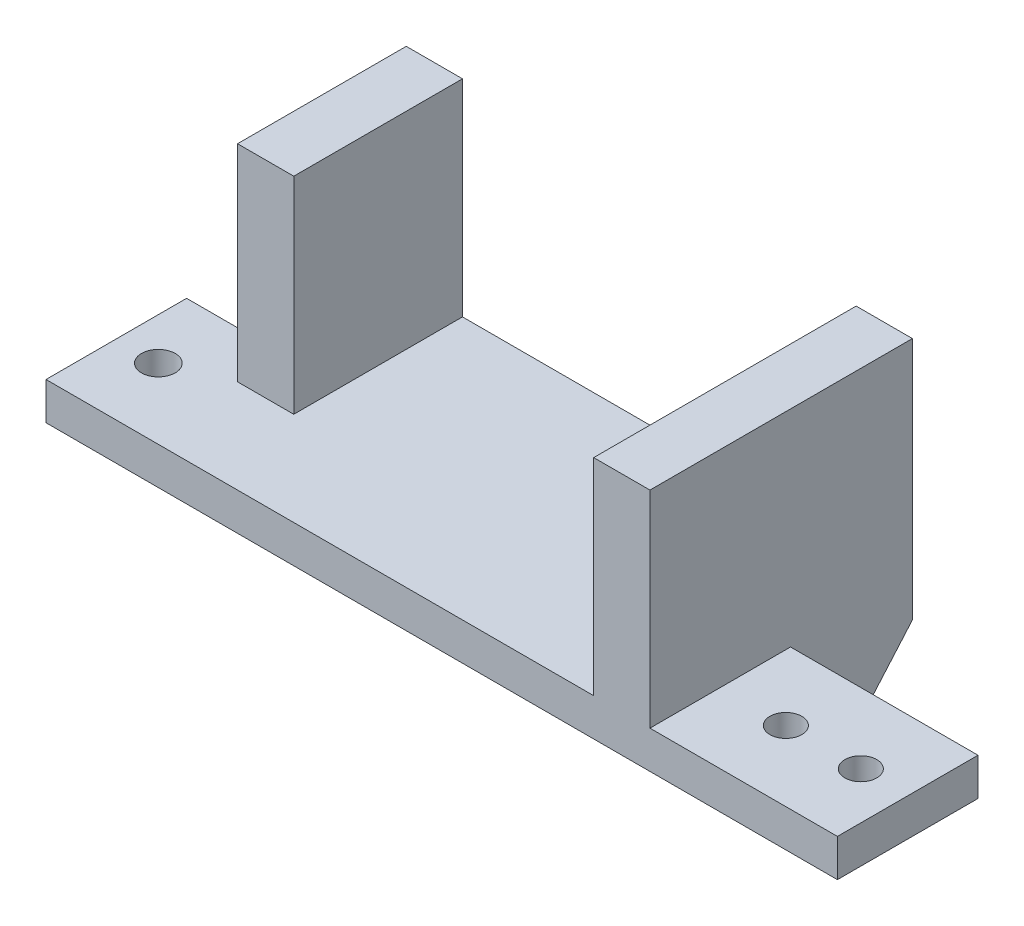
from build123d import *

# Parameters (mm, degrees)
BOSS_EXTRUDE1_DEPTH = 15
BOSS_EXTRUDE2_DEPTH = 13
SKETCH3_R           = 1.8
CUT_EXTRUDE1_DEPTH  = 10
SKETCH4_R           = 1.7
SKETCH4_W           = 9.565194399
SKETCH4_H           = 15
SKETCH4_R_2         = 1.8
CUT_EXTRUDE2_DEPTH  = 15
SKETCH5_W           = 6
SKETCH5_H           = 10
CUT_EXTRUDE3_DEPTH  = 22
BOSS_EXTRUDE3_DEPTH = 54
SKETCH7_W           = 18
SKETCH7_H           = 15
CUT_EXTRUDE4_DEPTH  = 11


with BuildPart() as part:
    # Sketch1 → Boss-Extrude1 (new body)
    with BuildSketch(Plane.XY):
        Polygon((-21, 4), (-21, 26), (-27, 26), (-27, 4), (-47, 4), (-47, 0), (47, 0), (47, 4), (27, 4), (27, 26), (21, 26), (21, 4), align=None)
    extrude(amount=BOSS_EXTRUDE1_DEPTH)

    # Sketch2 → Boss-Extrude2 (add)
    with BuildSketch(Plane(origin=(0, 0, 0), x_dir=(-1, 0, 0), z_dir=(0, 0, -1))):
        Polygon((-27, 26), (-27, 0), (27, 0), (27, 4), (27, 26), (21, 26), (21, 4), (-21, 4), (-21, 26), align=None)
    extrude(amount=BOSS_EXTRUDE2_DEPTH)

    # Sketch3 → Cut-Extrude1 (cut)
    with BuildSketch(Plane(origin=(0, 0, -13), x_dir=(-1, 0, 0), z_dir=(0, 0, -1))):
        with Locations((-24, 20.95)):
            Circle(SKETCH3_R)
        with Locations((-24, 11.05)):
            Circle(SKETCH3_R)
        with Locations((24, 20.95)):
            Circle(SKETCH3_R)
        with Locations((24, 11.05)):
            Circle(SKETCH3_R)
    extrude(amount=-CUT_EXTRUDE1_DEPTH, mode=Mode.SUBTRACT)

    # Sketch4 → Cut-Extrude2 (cut)
    with BuildSketch(Plane(origin=(0, 4, 0), x_dir=(1, 0, 0), z_dir=(0, 1, 0))):
        with Locations((42, -7.5)):
            Circle(SKETCH4_R)
        with Locations((34, -7.5)):
            Circle(SKETCH4_R)
        with Locations((-42.2174028, -7.5)):
            Rectangle(SKETCH4_W, SKETCH4_H)
        with Locations((-32.949794347, -7.5)):
            Circle(SKETCH4_R_2)
    extrude(amount=-CUT_EXTRUDE2_DEPTH, mode=Mode.SUBTRACT)

    # Sketch5 → Cut-Extrude3 (cut)
    with BuildSketch(Plane(origin=(0, 26, 0), x_dir=(1, 0, 0), z_dir=(0, 1, 0))):
        with Locations((-24, -10)):
            Rectangle(SKETCH5_W, SKETCH5_H)
    extrude(amount=-CUT_EXTRUDE3_DEPTH, mode=Mode.SUBTRACT)

    # Sketch6 → Boss-Extrude3 (add)
    with BuildSketch(Plane.ZY.offset(27)):
        Polygon((-13, 0), (0, 0), (0, -15), align=None)
    extrude(amount=-BOSS_EXTRUDE3_DEPTH)

    # Sketch7 → Cut-Extrude4 (cut)
    with BuildSketch(Plane(origin=(0, 0, -13), x_dir=(-1, 0, 0), z_dir=(0, 0, -1))):
        with Locations((-12, -7.5)):
            Rectangle(SKETCH7_W, SKETCH7_H)
        with Locations((12, -7.5)):
            Rectangle(SKETCH7_W, SKETCH7_H)
    extrude(amount=-CUT_EXTRUDE4_DEPTH, mode=Mode.SUBTRACT)


solid = part.part
